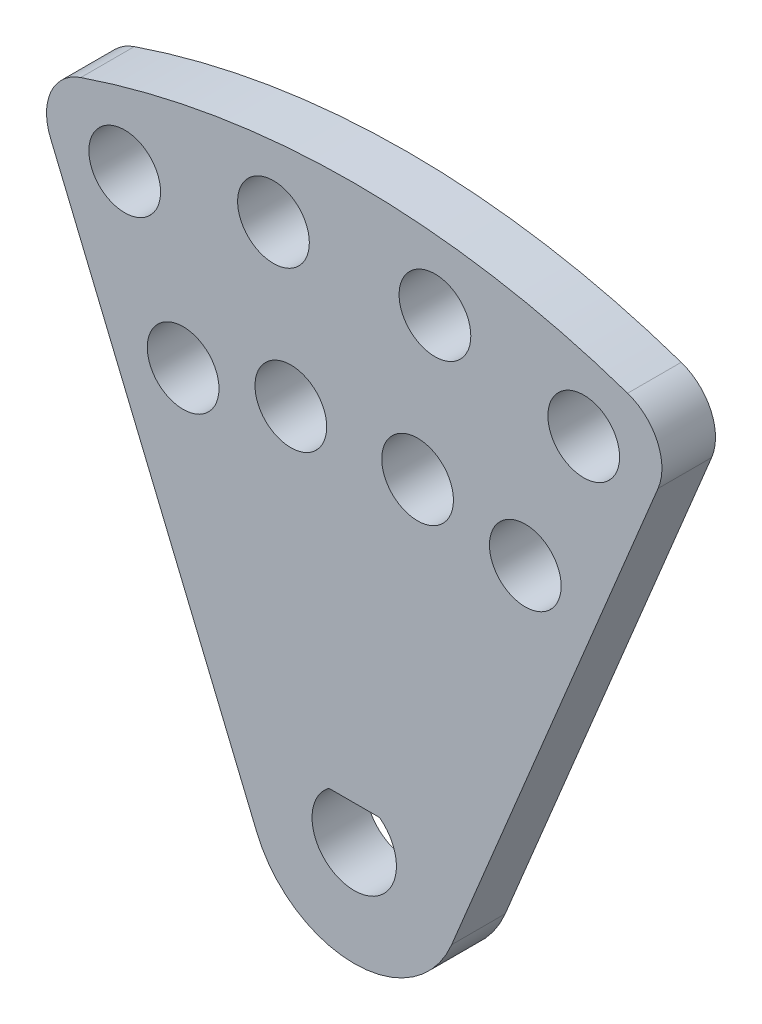
from build123d import *

# Parameters (mm, degrees)
SKETCH2_R           = 4.25
BOSS_EXTRUDE1_DEPTH = 6.35
FILLET1_R           = 6


with BuildPart() as part:
    # Sketch2 → Boss-Extrude1 (new body)
    with BuildSketch(Plane.XY):
        with BuildLine():
            Line((11.548494156, -4.783542905), (38.382716246, 60))
            ThreePointArc((38.382716246, 60), (0, 67.634796955), (-38.382716246, 60))
            Line((-38.382716246, 60), (-11.548494156, -4.783542905))
            ThreePointArc((-11.548494156, -4.783542905), (0, -12.5), (11.548494156, -4.783542905))
        make_face()
        with Locations((-27.203312061, 55.222101201)):
            Circle(SKETCH2_R, mode=Mode.SUBTRACT)
        with Locations((-9.56999846, 58.836828221)):
            Circle(SKETCH2_R, mode=Mode.SUBTRACT)
        with Locations((9.56999846, 58.836828221)):
            Circle(SKETCH2_R, mode=Mode.SUBTRACT)
        with Locations((27.203312061, 55.222101201)):
            Circle(SKETCH2_R, mode=Mode.SUBTRACT)
        with Locations((-20.278160914, 38.503307381)):
            Circle(SKETCH2_R, mode=Mode.SUBTRACT)
        with Locations((-7.511195711, 40.953735809)):
            Circle(SKETCH2_R, mode=Mode.SUBTRACT)
        with Locations((7.511195711, 40.953735809)):
            Circle(SKETCH2_R, mode=Mode.SUBTRACT)
        with Locations((20.278160914, 38.503307381)):
            Circle(SKETCH2_R, mode=Mode.SUBTRACT)
        with BuildLine():
            Line((-3, 4), (3, 4))
            ThreePointArc((3, 4), (0, -5), (-3, 4))
        make_face(mode=Mode.SUBTRACT)
    extrude(amount=BOSS_EXTRUDE1_DEPTH)

    # Fillet1
    fillet1_edges = [part.edges().sort_by_distance(p)[0] for p in [
        (38.382716246, 60, 3.175),
        (-38.382716246, 60, 3.175),
    ]]
    fillet(fillet1_edges, radius=FILLET1_R)


solid = part.part
